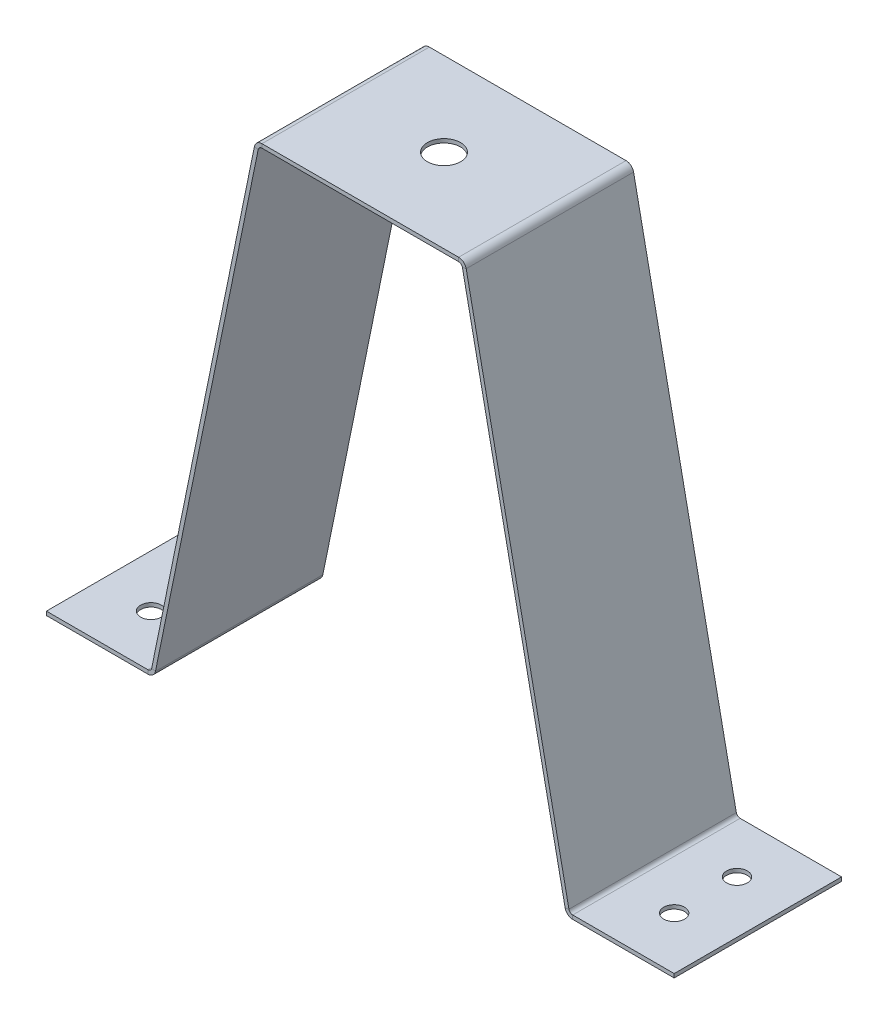
from build123d import *

# Parameters (mm, degrees)
BASE_FLANGE1_DEPTH = 16
SKETCH6_R          = 1.984375
SKETCH6_R_2        = 3.175
CUT_EXTRUDE1_DEPTH = 117.622837005


# Sheet-metal steps are written as plain solids
with BuildPart() as part:
    # Sketch1 → Base-Flange1 (new, symmetric)
    with BuildSketch(Plane.XY):
        with BuildLine():
            Line((-60, 0), (-40.601431382, 0))
            ThreePointArc((-40.601431382, 0), (-40.135564637, 0.166032093), (-39.879713724, 0.58928))
            Line((-39.879713724, 0.58928), (-20.240572553, 96.801029711))
            ThreePointArc((-20.240572553, 96.801029711), (-19.728870727, 97.647525524), (-18.797137237, 97.979589711))
            Line((-18.797137237, 97.979589711), (18.797137237, 97.979589711))
            ThreePointArc((18.797137237, 97.979589711), (19.728870727, 97.647525524), (20.240572553, 96.801029711))
            Line((20.240572553, 96.801029711), (39.879713724, 0.58928))
            ThreePointArc((39.879713724, 0.58928), (40.135564637, 0.166032093), (40.601431382, 0))
            Line((40.601431382, 0), (60, 0))
            Line((60, 0), (60, -0.7366))
            Line((60, -0.7366), (40.601431382, -0.7366))
            ThreePointArc((40.601431382, -0.7366), (39.669697892, -0.404535813), (39.157996066, 0.44196))
            Line((39.157996066, 0.44196), (19.518854895, 96.653709711))
            ThreePointArc((19.518854895, 96.653709711), (19.263003982, 97.076957618), (18.797137237, 97.242989711))
            Line((18.797137237, 97.242989711), (-18.797137237, 97.242989711))
            ThreePointArc((-18.797137237, 97.242989711), (-19.263003982, 97.076957618), (-19.518854895, 96.653709711))
            Line((-19.518854895, 96.653709711), (-39.157996066, 0.44196))
            ThreePointArc((-39.157996066, 0.44196), (-39.669697892, -0.404535813), (-40.601431382, -0.7366))
            Line((-40.601431382, -0.7366), (-60, -0.7366))
            Line((-60, -0.7366), (-60, 0))
        make_face()
    extrude(amount=BASE_FLANGE1_DEPTH, both=True)

    # Sketch6 → Cut-Extrude1 (cut, through all)
    with BuildSketch(Plane(origin=(0, 97.979589711, 0), x_dir=(1, 0, 0), z_dir=(0, 1, 0))):
        with Locations(Location((-50, 6, 0), (0, 0, 270))):
            Circle(SKETCH6_R)
        with Locations(Location((-50, -6, 0), (0, 0, 270))):
            Circle(SKETCH6_R)
        with Locations(Location((0, 0, 0), (0, 0, 270))):
            Circle(SKETCH6_R_2)
        with Locations(Location((50, -6, 0), (0, 0, 180))):
            Circle(SKETCH6_R)
        with Locations(Location((50, 6, 0), (0, 0, 180))):
            Circle(SKETCH6_R)
    extrude(amount=-CUT_EXTRUDE1_DEPTH, mode=Mode.SUBTRACT)


solid = part.part
